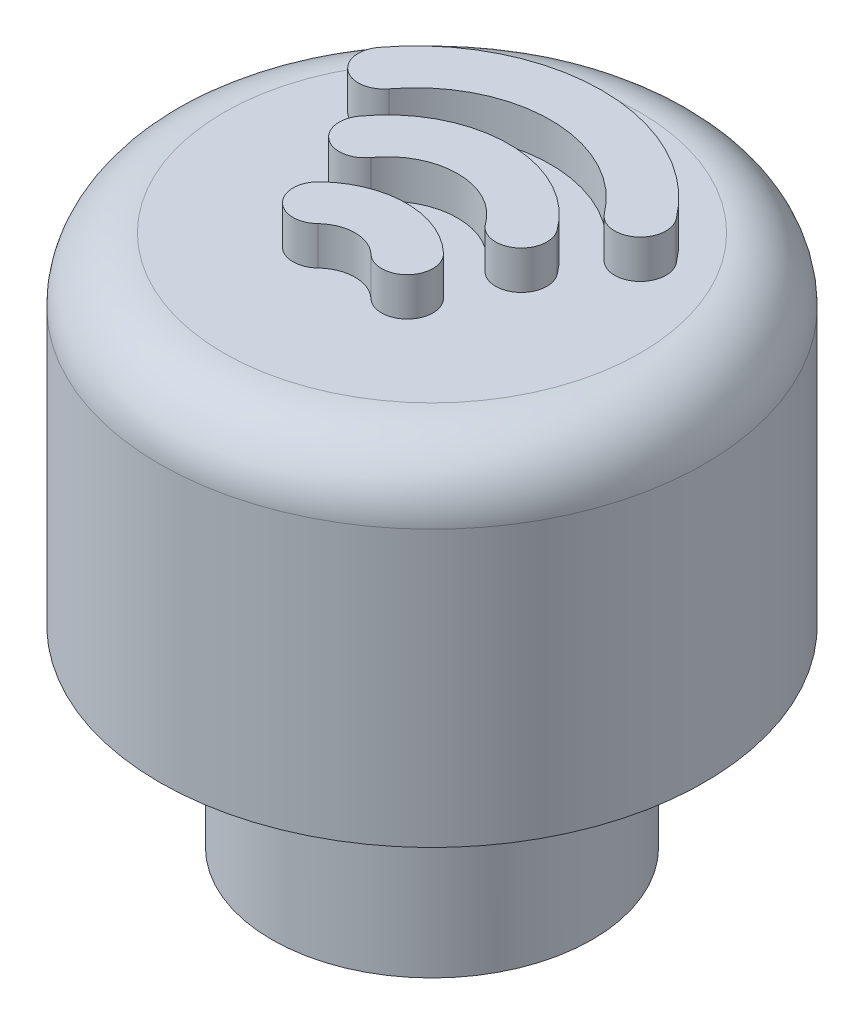
from build123d import *

# Parameters (mm, degrees)
SKETCH1_R           = 4.25
BOSS_EXTRUDE1_DEPTH = 5.3
SKETCH2_R           = 2.5
BOSS_EXTRUDE2_DEPTH = 3
SHELL2_T            = -0.7
FILLET1_R           = 1
BOSS_EXTRUDE4_DEPTH = 0.6


with BuildPart() as part:
    # Sketch1 → Boss-Extrude1 (new body)
    with BuildSketch(Plane(origin=(0, 0, 0), x_dir=(1, 0, 0), z_dir=(0, 1, 0))):
        Circle(SKETCH1_R)
    extrude(amount=BOSS_EXTRUDE1_DEPTH)

    # Sketch2 → Boss-Extrude2 (add)
    with BuildSketch(Plane.XZ):
        Circle(SKETCH2_R)
    extrude(amount=BOSS_EXTRUDE2_DEPTH)

    # Shell2
    shell2_openings = [part.faces().sort_by_distance(p)[0] for p in [
        (0, -3, 0),
    ]]
    offset(amount=SHELL2_T, openings=shell2_openings, kind=Kind.INTERSECTION)

    # Fillet1
    fillet1_edges = [part.edges().sort_by_distance(p)[0] for p in [
        (-4.25, 5.3, 0),
    ]]
    fillet(fillet1_edges, radius=FILLET1_R)

    # Sketch3 → Boss-Extrude4 (add)
    with BuildSketch(Plane(origin=(0, 5.3, 0), x_dir=(1, 0, 0), z_dir=(0, 1, 0))):
        with BuildLine():
            ThreePointArc((0.966334519, -0.786985884), (0, -0.4), (-0.966334519, -0.786985884))
            ThreePointArc((-0.966334519, -0.786985884), (-0.979671546, -1.352514066), (-0.414143365, -1.365851093))
            ThreePointArc((-0.414143365, -1.365851093), (0, -1.2), (0.414143365, -1.365851093))
            ThreePointArc((0.414143365, -1.365851093), (0.979671546, -1.352514066), (0.966334519, -0.786985884))
        make_face()
        with BuildLine():
            ThreePointArc((1.545056478, 0.405803093), (0, 1.2), (-1.545056478, 0.405803093))
            ThreePointArc((-1.545056478, 0.405803093), (-1.452582081, -0.152272606), (-0.894506382, -0.059798209))
            ThreePointArc((-0.894506382, -0.059798209), (0, 0.4), (0.894506382, -0.059798209))
            ThreePointArc((0.894506382, -0.059798209), (1.452582081, -0.152272606), (1.545056478, 0.405803093))
        make_face()
        with BuildLine():
            ThreePointArc((2.32, 1.49), (0, 2.65), (-2.32, 1.49))
            ThreePointArc((-2.32, 1.49), (-2.24, 0.93), (-1.68, 1.01))
            ThreePointArc((-1.68, 1.01), (0, 1.85), (1.68, 1.01))
            ThreePointArc((1.68, 1.01), (2.24, 0.93), (2.32, 1.49))
        make_face()
    extrude(amount=BOSS_EXTRUDE4_DEPTH)


solid = part.part
